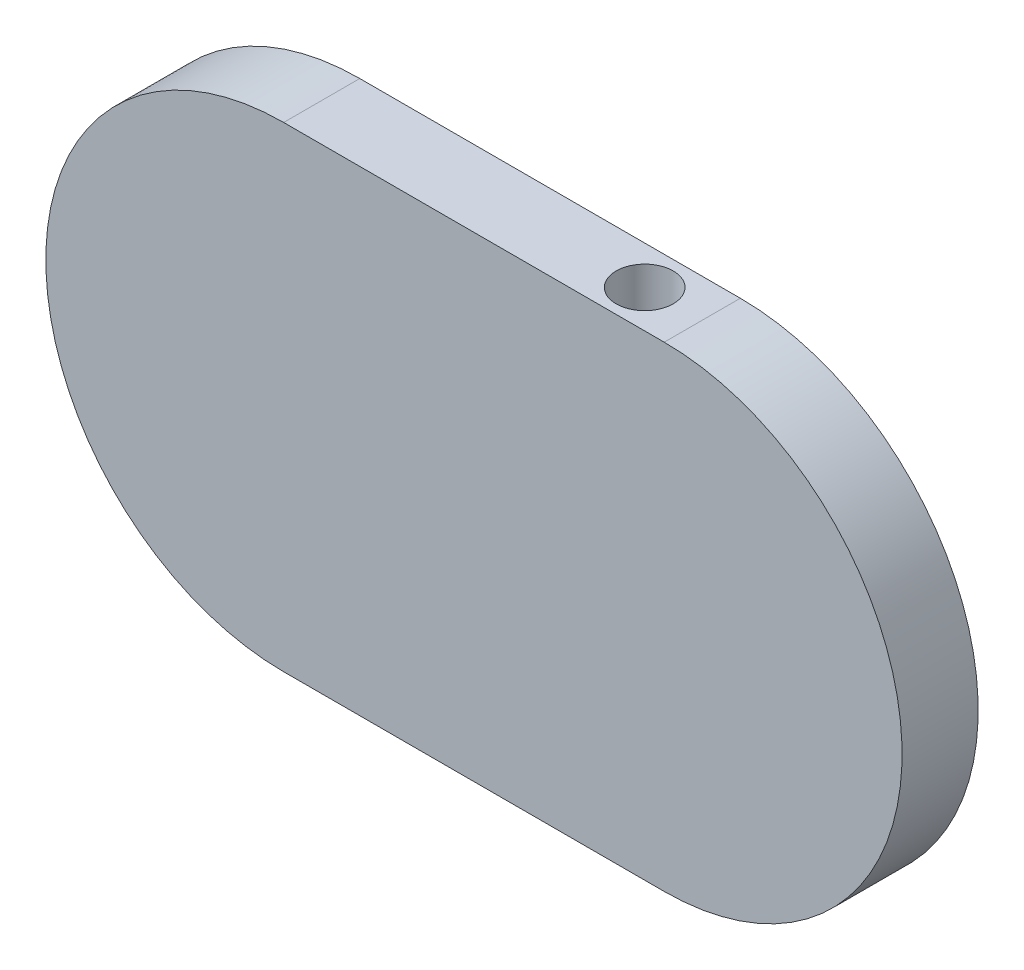
from build123d import *

# Parameters (mm, degrees)
BOSS_EXTRUDE1_DEPTH = 80
SKETCH2_R           = 30
CUT_EXTRUDE1_DEPTH  = 795.858645519
SKETCH4_R           = 97
BOSS_EXTRUDE3_DEPTH = 80
FILLET1_R           = 81.12


with BuildPart() as part:
    # Sketch1 → Boss-Extrude1 (new body)
    with BuildSketch(Plane.XY):
        with BuildLine():
            Line((-37.300835355, 250), (362.699164645, 250))
            ThreePointArc((362.699164645, 250), (612.699164645, 0), (362.699164645, -250))
            Line((362.699164645, -250), (-37.300835355, -250))
            ThreePointArc((-37.300835355, -250), (-287.300835355, 0), (-37.300835355, 250))
        make_face()
    extrude(amount=BOSS_EXTRUDE1_DEPTH)

    # Sketch2 → Cut-Extrude1 (cut, through all)
    with BuildSketch(Plane(origin=(0, 250, 0), x_dir=(1, 0, 0), z_dir=(0, 1, 0))):
        with Locations(Location((302.549396618, -40.40928544, 0), (0, 0, 270))):
            Circle(SKETCH2_R)
    extrude(amount=-CUT_EXTRUDE1_DEPTH, mode=Mode.SUBTRACT)

    # Sketch4 → Boss-Extrude3 (add)
    with BuildSketch(Plane(origin=(0, 0, 0), x_dir=(-1, 0, 0), z_dir=(0, 0, -1))):
        with Locations(Location((125.244285171, 0, 0), (0, 0, 180))):
            Circle(SKETCH4_R)
    extrude(amount=BOSS_EXTRUDE3_DEPTH)

    # Fillet1
    # the kernel refuses this fillet: 81.12 mm, written as the material it takes off along each edge
    with BuildSketch(Plane(origin=(-125.244285171, 0, -80), x_dir=(1, 0, 0), z_dir=(0, 1, 0))) as fillet1_piece_1:
        with BuildLine():
            CenterArc((15.887732124, -81.12), FILLET1_R, 0.791091124, 89.208908876)
            Line((15.887732124, 0), (15.887732124, 1.6224))
            Line((15.887732124, 1.6224), (97, 1.6224))
            Line((97, 1.6224), (98.6224, 0))
            ThreePointArc((98.6224, 0), (98.6224, -40), (98.622245358, -79.9776))
            Line((98.622245358, -79.9776), (97, -80))
        make_face()
    revolve(axis=Axis((-125.244285171, 0, -80), (0, 0, -1)), mode=Mode.SUBTRACT)


solid = part.part
